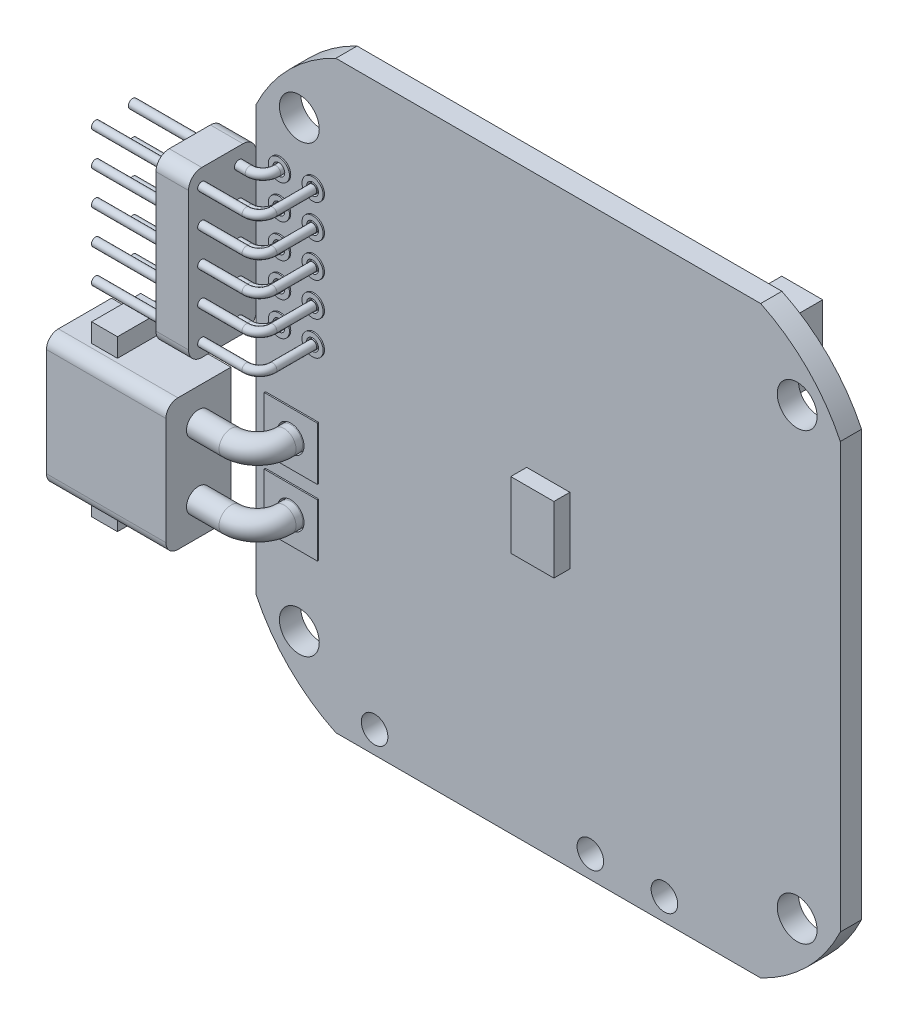
from build123d import *

# Parameters (mm, degrees)
SALIENTE_EXTRUIR1_DEPTH    = 0.8
CROQUIS2_R                 = 1.5
CORTAR_EXTRUIR1_DEPTH      = 32.153811966
CROQUIS3_W                 = 3.25
CROQUIS3_H                 = 5
SALIENTE_EXTRUIR2_DEPTH    = 1.2
CROQUIS4_R                 = 0.445
CORTAR_EXTRUIR2_DEPTH      = 32.238437861
CROQUIS5_R                 = 0.79739254
CROQUIS5_R_2               = 0.445
CROQUIS5_W                 = 4
CROQUIS5_H                 = 4
SALIENTE_EXTRUIR3_DEPTH    = 0.9
CORTAR_EXTRUIR3_DEPTH      = 32.247559905
CORTAR_EXTRUIR3_DEPTH_BACK = 32.247559905
CROQUIS6_R                 = 1
CROQUIS7_R                 = 1
CORTAR_EXTRUIR4_DEPTH      = 10
CROQUIS8_W                 = 3
CROQUIS8_H                 = 2.5
SALIENTE_EXTRUIR4_DEPTH    = 1.2
CROQUIS9_R                 = 0.75
SALIENTE_EXTRUIR5_DEPTH    = 0.8
CROQUIS10_W                = 5
CROQUIS10_H                = 5
SALIENTE_EXTRUIR6_DEPTH    = 0.9
SALIENTE_EXTRUIR7_START    = 0.1
CROQUIS11_R                = 1
SALIENTE_EXTRUIR7_DEPTH    = 0.1
SALIENTE_EXTRUIR8_DEPTH    = 0.75
CROQUIS13_W                = 3.080395022
CROQUIS13_H                = 5.233680862
SALIENTE_EXTRUIR9_DEPTH    = 2.65
CROQUIS14_W                = 3.82
CROQUIS14_H                = 3.82
SALIENTE_EXTRUIR10_DEPTH   = 3
CHAFL_N1_SIZE              = 1
BARRER2_OUTLINE_R          = 0.335
BARRER2_ANGLE              = 90
BARRER2_START              = 0.9
BARRER2_2_OUTLINE_R        = 0.335
BARRER2_2_DEPTH            = 0.2000001
BARRER2_START_2            = -30
BARRER2_3_OUTLINE_R        = 0.335
BARRER2_3_DEPTH            = 8.8070001
BARRER6_OUTLINE_R          = 0.31
BARRER6_ANGLE              = 90
BARRER6_START              = 0.9
BARRER6_2_OUTLINE_R        = 0.31
BARRER6_2_DEPTH            = 3.0000001
BARRER6_START_2            = -30
BARRER6_3_OUTLINE_R        = 0.31
BARRER6_3_DEPTH            = 11.3470001
MATRIZL2_COUNT             = 5
MATRIZL2_PITCH             = 2.54
MATRIZL3_COUNT             = 5
MATRIZL3_PITCH             = 2.54
SALIENTE_EXTRUIR11_DEPTH   = 2.45
BARRER7_OUTLINE_R          = 0.9
BARRER7_ANGLE              = 90
BARRER7_START              = 0.9
BARRER7_2_OUTLINE_R        = 0.9
BARRER7_2_DEPTH            = 0.5000001
BARRER7_START_2            = -23.75
BARRER7_3_OUTLINE_R        = 0.9
BARRER7_3_DEPTH            = 2.4500001
MATRIZL4_COUNT             = 2
MATRIZL4_PITCH             = 5
SALIENTE_EXTRUIR12_START   = 2.5
CROQUIS23_R                = 0.335
CROQUIS23_R_2              = 0.9
SALIENTE_EXTRUIR12_DEPTH   = 2.5
CROQUIS25_W                = 4.9
CROQUIS25_H                = 9.9
SALIENTE_EXTRUIR13_DEPTH   = 9
CROQUIS26_R                = 0.916186406
CORTAR_EXTRUIR6_DEPTH      = 8.5
REDONDEO1_R                = 0.9
REDONDEO2_R                = 0.9
CROQUIS27_W                = 1.95
CROQUIS27_H                = 1.41
SALIENTE_EXTRUIR14_DEPTH   = 3.7
CROQUIS28_R                = 0.44
SALIENTE_EXTRUIR15_DEPTH   = 3.2


with BuildPart() as part:
    # Croquis1 → Saliente-Extruir1 (new, symmetric)
    with BuildSketch(Plane.XY):
        with BuildLine():
            Line((-22, 16), (-22, -16))
            ThreePointArc((-22, -16), (-19.513773424, -19.513773424), (-16, -22))
            Line((-16, -22), (16, -22))
            ThreePointArc((16, -22), (19.513773424, -19.513773424), (22, -16))
            Line((22, -16), (22, 16))
            ThreePointArc((22, 16), (19.513773424, 19.513773424), (16, 22))
            Line((16, 22), (-16, 22))
            ThreePointArc((-16, 22), (-19.513773424, 19.513773424), (-22, 16))
        make_face()
    extrude(amount=SALIENTE_EXTRUIR1_DEPTH, both=True)

    # Croquis2 → Cortar-Extruir1 (cut, through all)
    with BuildSketch(Plane.XY.offset(0.8)):
        with Locations((-18.75, 16.75)):
            Circle(CROQUIS2_R)
        with Locations((18.75, 16.75)):
            Circle(CROQUIS2_R)
        with Locations((18.75, -16.75)):
            Circle(CROQUIS2_R)
        with Locations((-18.75, -16.75)):
            Circle(CROQUIS2_R)
    extrude(amount=-CORTAR_EXTRUIR1_DEPTH, mode=Mode.SUBTRACT)

    # Croquis3 → Saliente-Extruir2 (add)
    with BuildSketch(Plane.XY.offset(0.8)):
        Rectangle(CROQUIS3_W, CROQUIS3_H)
    extrude(amount=SALIENTE_EXTRUIR2_DEPTH)

    # Croquis4 → Cortar-Extruir2 (cut, through all)
    with BuildSketch(Plane(origin=(0, 0, -0.8), x_dir=(-1, 0, 0), z_dir=(0, 0, -1))):
        with Locations((17.653, 12.7)):
            Circle(CROQUIS4_R)
        with Locations((20.193, 12.7)):
            Circle(CROQUIS4_R)
        with Locations((20.193, 10.16)):
            Circle(CROQUIS4_R)
        with Locations((20.193, 7.62)):
            Circle(CROQUIS4_R)
        with Locations((20.193, 5.08)):
            Circle(CROQUIS4_R)
        with Locations((20.193, 2.54)):
            Circle(CROQUIS4_R)
        with Locations((17.653, 10.16)):
            Circle(CROQUIS4_R)
        with Locations((17.653, 7.62)):
            Circle(CROQUIS4_R)
        with Locations((17.653, 5.08)):
            Circle(CROQUIS4_R)
        with Locations((17.653, 2.54)):
            Circle(CROQUIS4_R)
    extrude(amount=-CORTAR_EXTRUIR2_DEPTH, mode=Mode.SUBTRACT)

    # Croquis5 → Saliente-Extruir3 (add, symmetric)
    # profile 1 of 12: a face of its own
    with BuildSketch(Plane.XY):
        with Locations((-17.653, 2.54)):
            Circle(CROQUIS5_R)
        with Locations((-17.653, 2.54)):
            Circle(CROQUIS5_R_2, mode=Mode.SUBTRACT)
    # profile 2 of 12: a face of its own
    with BuildSketch(Plane.XY):
        with Locations((-20.193, 2.54)):
            Circle(CROQUIS5_R)
        with Locations((-20.193, 2.54)):
            Circle(CROQUIS5_R_2, mode=Mode.SUBTRACT)
    # profile 3 of 12: a face of its own
    with BuildSketch(Plane.XY):
        with Locations((-20.193, 5.08)):
            Circle(CROQUIS5_R)
        with Locations((-20.193, 5.08)):
            Circle(CROQUIS5_R_2, mode=Mode.SUBTRACT)
    # profile 4 of 12: a face of its own
    with BuildSketch(Plane.XY):
        with Locations((-17.653, 5.08)):
            Circle(CROQUIS5_R)
        with Locations((-17.653, 5.08)):
            Circle(CROQUIS5_R_2, mode=Mode.SUBTRACT)
    # profile 5 of 12: a face of its own
    with BuildSketch(Plane.XY):
        with Locations((-17.653, 7.62)):
            Circle(CROQUIS5_R)
        with Locations((-17.653, 7.62)):
            Circle(CROQUIS5_R_2, mode=Mode.SUBTRACT)
    # profile 6 of 12: a face of its own
    with BuildSketch(Plane.XY):
        with Locations((-17.653, 10.16)):
            Circle(CROQUIS5_R)
        with Locations((-17.653, 10.16)):
            Circle(CROQUIS5_R_2, mode=Mode.SUBTRACT)
    # profile 7 of 12: a face of its own
    with BuildSketch(Plane.XY):
        with Locations((-20.193, 7.62)):
            Circle(CROQUIS5_R)
        with Locations((-20.193, 7.62)):
            Circle(CROQUIS5_R_2, mode=Mode.SUBTRACT)
    # profile 8 of 12: a face of its own
    with BuildSketch(Plane.XY):
        with Locations((-20.193, 10.16)):
            Circle(CROQUIS5_R)
        with Locations((-20.193, 10.16)):
            Circle(CROQUIS5_R_2, mode=Mode.SUBTRACT)
    # profile 9 of 12: a face of its own
    with BuildSketch(Plane.XY):
        with Locations((-17.653, 12.7)):
            Circle(CROQUIS5_R)
        with Locations((-17.653, 12.7)):
            Circle(CROQUIS5_R_2, mode=Mode.SUBTRACT)
    # profile 10 of 12: a face of its own
    with BuildSketch(Plane.XY):
        with Locations((-20.193, 12.7)):
            Circle(CROQUIS5_R)
        with Locations((-20.193, 12.7)):
            Circle(CROQUIS5_R_2, mode=Mode.SUBTRACT)
    # profile 11 of 12: a face of its own
    with BuildSketch(Plane.XY):
        with Locations((-19.3, -4.4)):
            Rectangle(CROQUIS5_W, CROQUIS5_H)
    # profile 12 of 12: a face of its own
    with BuildSketch(Plane.XY):
        with Locations((-19.3, -9.4)):
            Rectangle(CROQUIS5_W, CROQUIS5_H)
    extrude(amount=SALIENTE_EXTRUIR3_DEPTH, both=True)

    # Croquis6 → Cortar-Extruir3 (cut, two sides: drawn at the far end of the back side and taken through both)
    with BuildSketch(Plane(origin=(0, 0, -0.9), x_dir=(-1, 0, 0), z_dir=(0, 0, -1)).offset(-CORTAR_EXTRUIR3_DEPTH_BACK)):
        with Locations((19.3, -4.4)):
            Circle(CROQUIS6_R)
        with Locations((19.3, -9.4)):
            Circle(CROQUIS6_R)
    extrude(amount=CORTAR_EXTRUIR3_DEPTH + CORTAR_EXTRUIR3_DEPTH_BACK, mode=Mode.SUBTRACT)

    # Croquis7 → Cortar-Extruir4 (cut)
    with BuildSketch(Plane(origin=(0, 0, -0.8), x_dir=(-1, 0, 0), z_dir=(0, 0, -1))):
        with Locations((-8.75, -20.32)):
            Circle(CROQUIS7_R)
        with Locations((-3.17, -20.32)):
            Circle(CROQUIS7_R)
        with Locations((13.08, -20.32)):
            Circle(CROQUIS7_R)
    extrude(amount=-CORTAR_EXTRUIR4_DEPTH, mode=Mode.SUBTRACT)

    # Croquis8 → Saliente-Extruir4 (add)
    with BuildSketch(Plane(origin=(0, 0, -0.8), x_dir=(-1, 0, 0), z_dir=(0, 0, -1))):
        with Locations((-19, 11.935)):
            Rectangle(CROQUIS8_W, CROQUIS8_H)
        with Locations((-19, 8.935)):
            Rectangle(CROQUIS8_W, CROQUIS8_H)
    extrude(amount=SALIENTE_EXTRUIR4_DEPTH)

    # Croquis9 → Saliente-Extruir5 (add)
    with BuildSketch(Plane(origin=(0, 0, -2), x_dir=(-1, 0, 0), z_dir=(0, 0, -1))):
        with Locations((-19, 11.935)):
            Circle(CROQUIS9_R)
        with Locations((-19, 8.935)):
            Circle(CROQUIS9_R)
    extrude(amount=SALIENTE_EXTRUIR5_DEPTH)

    # Croquis10 → Saliente-Extruir6 (add)
    with BuildSketch(Plane(origin=(0, 0, -0.8), x_dir=(-1, 0, 0), z_dir=(0, 0, -1))):
        with Locations((-13.5, -16.75)):
            Rectangle(CROQUIS10_W, CROQUIS10_H)
        with Locations((13.75, -14.7)):
            Rectangle(CROQUIS10_W, CROQUIS10_H)
        with Locations((8.387686328, -16.75)):
            Rectangle(CROQUIS10_W, CROQUIS10_H)
        with Locations((2.934297752, -16.75)):
            Rectangle(CROQUIS10_W, CROQUIS10_H)
        with Locations((-2.448267596, -14.7)):
            Rectangle(CROQUIS10_W, CROQUIS10_H)
        with Locations((-8.043302629, -14.7)):
            Rectangle(CROQUIS10_W, CROQUIS10_H)
    extrude(amount=SALIENTE_EXTRUIR6_DEPTH)

    # Croquis11 → Saliente-Extruir7 (add)
    # profile 1 of 3: a face of its own
    with BuildSketch(Plane(origin=(0, 0, -0.8), x_dir=(-1, 0, 0), z_dir=(0, 0, -1)).offset(SALIENTE_EXTRUIR7_START)):
        Polygon((-13.652894244, -19.522521794), (-10.45933095, -19.522521794), (-9.812366284, -18.875557129), (-7.528981863, -18.875557129), (-7.147566948, -19.256972043), (-7.147566948, -21.343674777), (-7.528981863, -21.725089692), (-13.830102074, -21.725089692), (-14.141358707, -21.413833058), (-14.141358707, -20.010986258), align=None)
        with Locations((-8.75, -20.32)):
            Circle(CROQUIS11_R, mode=Mode.SUBTRACT)
    # profile 2 of 3: a face of its own
    with BuildSketch(Plane(origin=(0, 0, -0.8), x_dir=(-1, 0, 0), z_dir=(0, 0, -1)).offset(SALIENTE_EXTRUIR7_START)):
        Polygon((8.172318821, -19.522521794), (11.198277852, -19.522521794), (12.022450347, -18.698349299), (14.296231203, -18.698349299), (14.77845979, -19.180577887), (14.77845979, -21.242861104), (14.296231203, -21.725089692), (7.995110992, -21.725089692), (7.683854358, -21.413833058), (7.683854358, -20.010986258), align=None)
        with Locations((13.08, -20.32)):
            Circle(CROQUIS11_R, mode=Mode.SUBTRACT)
    # profile 3 of 3: a face of its own
    with BuildSketch(Plane(origin=(0, 0, -0.8), x_dir=(-1, 0, 0), z_dir=(0, 0, -1)).offset(SALIENTE_EXTRUIR7_START)):
        Polygon((2.263089361, -20.010986258), (1.774624897, -19.522521794), (-1.418938397, -19.522521794), (-2.065903062, -18.875557129), (-4.349287484, -18.875557129), (-4.730702399, -19.256972043), (-4.730702399, -21.343674777), (-4.349287484, -21.725089692), (1.951832727, -21.725089692), (2.263089361, -21.413833058), align=None)
        with Locations((-3.17, -20.32)):
            Circle(CROQUIS11_R, mode=Mode.SUBTRACT)
    extrude(amount=-SALIENTE_EXTRUIR7_DEPTH)

    # Croquis12 → Saliente-Extruir8 (add)
    with BuildSketch(Plane(origin=(0, 0, -0.8), x_dir=(-1, 0, 0), z_dir=(0, 0, -1))):
        Polygon((-19.575208836, -2.789767852), (-13.48447481, -8.880501877), (-7.393740785, -2.789767852), (-13.48447481, 3.300966173), align=None)
    extrude(amount=SALIENTE_EXTRUIR8_DEPTH)

    # Croquis13 → Saliente-Extruir9 (add)
    with BuildSketch(Plane(origin=(0, 0, -0.8), x_dir=(-1, 0, 0), z_dir=(0, 0, -1))):
        with Locations((-14.88146784, 17.715085573)):
            Rectangle(CROQUIS13_W, CROQUIS13_H)
    extrude(amount=SALIENTE_EXTRUIR9_DEPTH)

    # Croquis14 → Saliente-Extruir10 (add)
    with BuildSketch(Plane(origin=(0, 0, -0.8), x_dir=(-1, 0, 0), z_dir=(0, 0, -1))):
        with Locations((-10.141101814, 15.498369959)):
            Rectangle(CROQUIS14_W, CROQUIS14_H)
    extrude(amount=SALIENTE_EXTRUIR10_DEPTH)

    # Chaflán1
    chafl_n1_edges = [part.edges().sort_by_distance(p)[0] for p in [
        (12.051101814, 17.408369959, -2.3),
        (12.051101814, 13.588369959, -2.3),
        (8.231101814, 13.588369959, -2.3),
        (8.231101814, 17.408369959, -2.3),
    ]]
    chamfer(chafl_n1_edges, length=CHAFL_N1_SIZE)



with BuildPart() as body_2:
    # Barrer2: read off the stored shape, not the designer's step
    # Barrer2 outline → Barrer2 (revolve)
    with BuildSketch(Plane(origin=(-21.193, 0, 1.1), x_dir=(0, 0, 1), z_dir=(-1, 0, 0))):
        with Locations((1, 12.7)):
            Circle(BARRER2_OUTLINE_R)
    revolve(axis=Axis((-21.193, 0, 1.1), (0, 1, 0)), revolution_arc=BARRER2_ANGLE)

    # Barrer2 2 outline → Barrer2 2 (add)
    with BuildSketch(Plane.XY.offset(BARRER2_START)):
        with Locations((-20.193, 12.7)):
            Circle(BARRER2_2_OUTLINE_R)
    extrude(amount=BARRER2_2_DEPTH)

    # Barrer2 3 outline → Barrer2 3 (add)
    with BuildSketch(Plane.YZ.offset(BARRER2_START_2)):
        with Locations((12.7, 2.1)):
            Circle(BARRER2_3_OUTLINE_R)
    extrude(amount=BARRER2_3_DEPTH)


with BuildPart() as body_3:
    # Barrer6: read off the stored shape, not the designer's step
    # Barrer6 outline → Barrer6 (revolve)
    with BuildSketch(Plane(origin=(-18.653, 0, 3.9), x_dir=(0, 0, 1), z_dir=(-1, 0, 0))):
        with Locations((1, 2.54)):
            Circle(BARRER6_OUTLINE_R)
    revolve(axis=Axis((-18.653, 0, 3.9), (0, 1, 0)), revolution_arc=BARRER6_ANGLE)

    # Barrer6 2 outline → Barrer6 2 (add)
    with BuildSketch(Plane.XY.offset(BARRER6_START)):
        with Locations((-17.653, 2.54)):
            Circle(BARRER6_2_OUTLINE_R)
    extrude(amount=BARRER6_2_DEPTH)

    # Barrer6 3 outline → Barrer6 3 (add)
    with BuildSketch(Plane.YZ.offset(BARRER6_START_2)):
        with Locations((2.54, 4.9)):
            Circle(BARRER6_3_OUTLINE_R)
    extrude(amount=BARRER6_3_DEPTH)


with BuildPart() as matrizl2_1:
    # MatrizL2: pattern copy
    add(body_2.part.moved(Location(Vector(0, -1, 0) * (1 * MATRIZL2_PITCH))))


with BuildPart() as matrizl2_2:
    # MatrizL2: pattern copy
    add(body_2.part.moved(Location(Vector(0, -1, 0) * (2 * MATRIZL2_PITCH))))


with BuildPart() as matrizl2_3:
    # MatrizL2: pattern copy
    add(body_2.part.moved(Location(Vector(0, -1, 0) * (3 * MATRIZL2_PITCH))))


with BuildPart() as matrizl2_4:
    # MatrizL2: pattern copy
    add(body_2.part.moved(Location(Vector(0, -1, 0) * (4 * MATRIZL2_PITCH))))


with BuildPart() as matrizl3_1:
    # MatrizL3: pattern copy
    add(body_3.part.moved(Location(Vector(0, 1, 0) * (1 * MATRIZL3_PITCH))))


with BuildPart() as matrizl3_2:
    # MatrizL3: pattern copy
    add(body_3.part.moved(Location(Vector(0, 1, 0) * (2 * MATRIZL3_PITCH))))


with BuildPart() as matrizl3_3:
    # MatrizL3: pattern copy
    add(body_3.part.moved(Location(Vector(0, 1, 0) * (3 * MATRIZL3_PITCH))))


with BuildPart() as matrizl3_4:
    # MatrizL3: pattern copy
    add(body_3.part.moved(Location(Vector(0, 1, 0) * (4 * MATRIZL3_PITCH))))


with BuildPart() as part_1:
    add(part.part)

    add(body_2.part)  # Saliente-Extruir11 merges body 2

    add(body_3.part)  # Saliente-Extruir11 merges body 3

    add(matrizl2_1.part)  # Saliente-Extruir11 merges MatrizL2_1

    add(matrizl2_2.part)  # Saliente-Extruir11 merges MatrizL2_2

    add(matrizl2_3.part)  # Saliente-Extruir11 merges MatrizL2_3

    add(matrizl2_4.part)  # Saliente-Extruir11 merges MatrizL2_4

    add(matrizl3_1.part)  # Saliente-Extruir11 merges MatrizL3_1

    add(matrizl3_2.part)  # Saliente-Extruir11 merges MatrizL3_2

    add(matrizl3_3.part)  # Saliente-Extruir11 merges MatrizL3_3

    add(matrizl3_4.part)  # Saliente-Extruir11 merges MatrizL3_4
    # Croquis22 → Saliente-Extruir11 (add)
    with BuildSketch(Plane.ZY.offset(22)):
        with BuildLine():
            Line((1.8, 13.925956015), (4.9, 13.925956015))
            ThreePointArc((4.9, 13.925956015), (5.607106781, 13.633062797), (5.9, 12.925956015))
            Line((5.9, 12.925956015), (5.9, 2.525956015))
            ThreePointArc((5.9, 2.525956015), (5.607106781, 1.818849234), (4.9, 1.525956015))
            Line((4.9, 1.525956015), (1.8, 1.525956015))
            ThreePointArc((1.8, 1.525956015), (1.092893219, 1.818849234), (0.8, 2.525956015))
            Line((0.8, 2.525956015), (0.8, 12.925956015))
            ThreePointArc((0.8, 12.925956015), (1.092893219, 13.633062797), (1.8, 13.925956015))
        make_face()
    extrude(amount=SALIENTE_EXTRUIR11_DEPTH)

    # Croquis23 → Saliente-Extruir12 (add)
    with BuildSketch(Plane(origin=(0, 0, 0.9), x_dir=(-1, 0, 0), z_dir=(0, 0, -1)).offset(SALIENTE_EXTRUIR12_START)):
        with Locations(Location((20.193, 2.54, 0), (0, 0, 180))):
            Circle(CROQUIS23_R)
        with Locations((17.653, 2.54)):
            Circle(CROQUIS23_R)
        with Locations((17.653, 5.08)):
            Circle(CROQUIS23_R)
        with Locations((17.653, 7.62)):
            Circle(CROQUIS23_R)
        with Locations((17.653, 10.16)):
            Circle(CROQUIS23_R)
        with Locations((17.653, 12.7)):
            Circle(CROQUIS23_R)
        with Locations(Location((20.193, 5.08, 0), (0, 0, 180))):
            Circle(CROQUIS23_R)
        with Locations(Location((20.193, 7.62, 0), (0, 0, 180))):
            Circle(CROQUIS23_R)
        with Locations(Location((20.193, 10.16, 0), (0, 0, 180))):
            Circle(CROQUIS23_R)
        with Locations(Location((20.193, 12.7, 0), (0, 0, 180))):
            Circle(CROQUIS23_R)
        with Locations((19.3, -4.4)):
            Circle(CROQUIS23_R_2)
        with Locations((19.3, -9.4)):
            Circle(CROQUIS23_R_2)
    extrude(amount=-SALIENTE_EXTRUIR12_DEPTH)


with BuildPart() as body_2_2:
    # Barrer7: read off the stored shape, not the designer's step
    # Barrer7 outline → Barrer7 (revolve)
    with BuildSketch(Plane(origin=(-21.3, 0, 1.4), x_dir=(0, 0, 1), z_dir=(-1, 0, 0))):
        with Locations((2, -4.4)):
            Circle(BARRER7_OUTLINE_R)
    revolve(axis=Axis((-21.3, 0, 1.4), (0, 1, 0)), revolution_arc=BARRER7_ANGLE)

    # Barrer7 2 outline → Barrer7 2 (add)
    with BuildSketch(Plane.XY.offset(BARRER7_START)):
        with Locations((-19.3, -4.4)):
            Circle(BARRER7_2_OUTLINE_R)
    extrude(amount=BARRER7_2_DEPTH)

    # Barrer7 3 outline → Barrer7 3 (add)
    with BuildSketch(Plane.YZ.offset(BARRER7_START_2)):
        with Locations((-4.4, 3.4)):
            Circle(BARRER7_3_OUTLINE_R)
    extrude(amount=BARRER7_3_DEPTH)


with BuildPart() as matrizl4_1:
    # MatrizL4: pattern copy
    add(body_2_2.part.moved(Location(Vector(0, -1, 0) * (1 * MATRIZL4_PITCH))))


with BuildPart() as body_2_2_1:
    add(body_2_2.part)

    add(matrizl4_1.part)  # Saliente-Extruir13 merges MatrizL4_1
    # Croquis25 → Saliente-Extruir13 (add)
    with BuildSketch(Plane.ZY.offset(23.75)):
        with Locations((3.4, -6.9)):
            Rectangle(CROQUIS25_W, CROQUIS25_H)
    extrude(amount=SALIENTE_EXTRUIR13_DEPTH)

    # Croquis26 → Cortar-Extruir6 (cut)
    with BuildSketch(Plane.ZY.offset(32.75)):
        Polygon((1.45, -3.318057697), (1.45, -11.35), (5.35, -11.35), (5.35, -3.318057697), (4.481942303, -2.45), (2.318057697, -2.45), align=None)
        with Locations((3.4, -4.4)):
            Circle(CROQUIS26_R, mode=Mode.SUBTRACT)
        with Locations((3.4, -9.4)):
            Circle(CROQUIS26_R, mode=Mode.SUBTRACT)
    extrude(amount=-CORTAR_EXTRUIR6_DEPTH, mode=Mode.SUBTRACT)

    # Redondeo1
    redondeo1_edges = [body_2_2_1.edges().sort_by_distance(p)[0] for p in [
        (-32.75, -9.4, 2.483813594),
        (-32.75, -4.4, 2.483813594),
    ]]
    fillet(redondeo1_edges, radius=REDONDEO1_R)

    # Redondeo2
    redondeo2_edges = [body_2_2_1.edges().sort_by_distance(p)[0] for p in [
        (-28.25, -11.85, 5.85),
        (-28.25, -1.95, 5.85),
    ]]
    fillet(redondeo2_edges, radius=REDONDEO2_R)

    # Croquis27 → Saliente-Extruir14 (add)
    with BuildSketch(Plane(origin=(0, 0, 0.95), x_dir=(-1, 0, 0), z_dir=(0, 0, -1))):
        with Locations((29.575, -1.245)):
            Rectangle(CROQUIS27_W, CROQUIS27_H)
        with Locations((29.575, -12.555)):
            Rectangle(CROQUIS27_W, CROQUIS27_H)
    extrude(amount=-SALIENTE_EXTRUIR14_DEPTH)

    # Croquis28 → Saliente-Extruir15 (add)
    with BuildSketch(Plane(origin=(0, 0, 0.95), x_dir=(-1, 0, 0), z_dir=(0, 0, -1))):
        with Locations(Location((29.575, -1.223852691, 0), (0, 0, 270))):
            Circle(CROQUIS28_R)
        with Locations(Location((29.575, -12.576147309, 0), (0, 0, 270))):
            Circle(CROQUIS28_R)
    extrude(amount=SALIENTE_EXTRUIR15_DEPTH)


solid = Compound([part_1.part, body_2_2_1.part])
